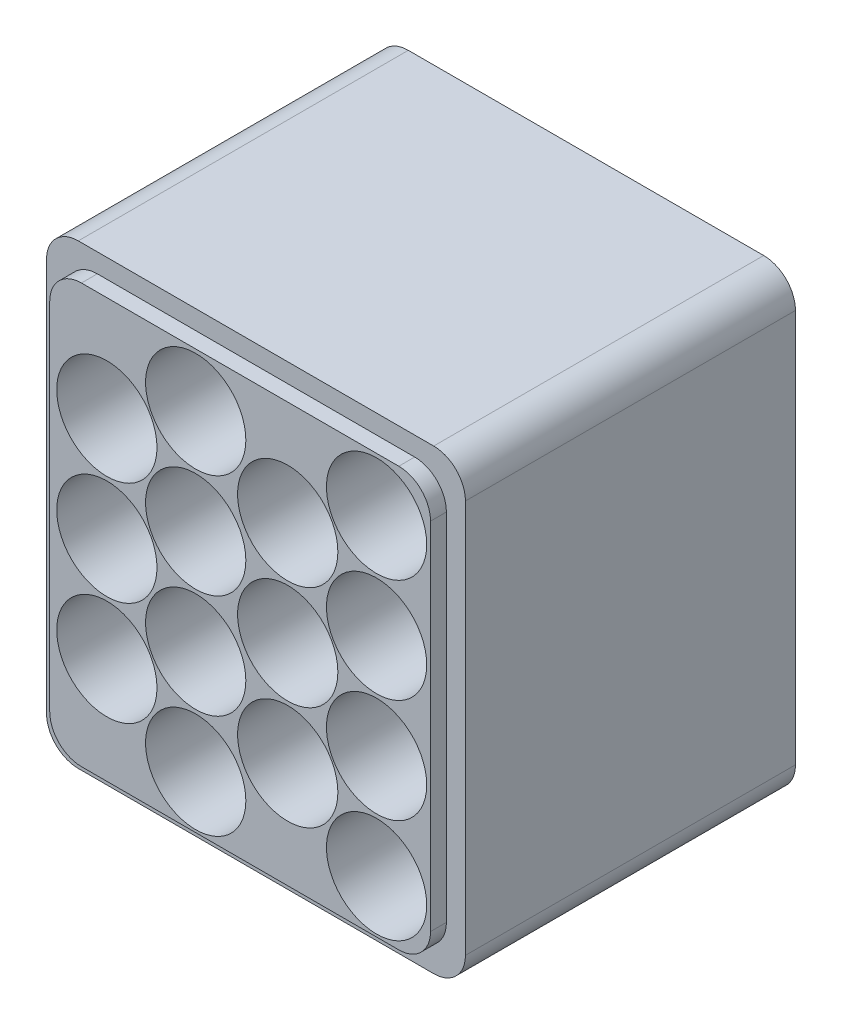
from build123d import *

# Parameters (mm, degrees)
SKETCH1_W                 = 66
SKETCH1_H                 = 72
BOSS_EXTRUDE1_DEPTH       = 52
SKETCH2_W                 = 60
SKETCH2_H                 = 66
BOSS_EXTRUDE2_DEPTH       = 2.5
SKETCH3_W                 = 62
SKETCH3_H                 = 68
CUT_EXTRUDE1_DEPTH        = 13
SKETCH4_R                 = 7.9
CUT_EXTRUDE2_DEPTH        = 37.5
LPATTERN1_COUNT           = 3
LPATTERN1_PITCH           = 16.4
LPATTERN1_COUNT_DIR2      = 2
LPATTERN1_PITCH_DIR2      = 28.5
SKETCH_PATTERN1_START     = 17
SKETCH_PATTERN1_OUTLINE_R = 7.9
SKETCH_PATTERN1_DEPTH     = 37.5
FILLET1_R                 = 5
FILLET2_R                 = 2


# Read off the part's stored shape, not the designer's step: Sketch-Pattern1
with BuildPart() as part:
    # Sketch1 → Boss-Extrude1 (new body)
    with BuildSketch(Plane.XY):
        Rectangle(SKETCH1_W, SKETCH1_H)
    extrude(amount=BOSS_EXTRUDE1_DEPTH)

    # Sketch2 → Boss-Extrude2 (add)
    with BuildSketch(Plane.XY.offset(52)):
        Rectangle(SKETCH2_W, SKETCH2_H)
    extrude(amount=BOSS_EXTRUDE2_DEPTH)

    # Sketch3 → Cut-Extrude1 (cut)
    with BuildSketch(Plane(origin=(0, 0, 0), x_dir=(-1, 0, 0), z_dir=(0, 0, -1))):
        Rectangle(SKETCH3_W, SKETCH3_H)
    extrude(amount=-CUT_EXTRUDE1_DEPTH, mode=Mode.SUBTRACT)

    # Sketch4 → Cut-Extrude2 (cut)
    with BuildSketch(Plane.XY.offset(54.5)):
        with Locations((21.5, 24.5)):
            Circle(SKETCH4_R)
    cut_extrude2 = extrude(amount=-CUT_EXTRUDE2_DEPTH, mode=Mode.SUBTRACT)

    # LPattern1: Cut-Extrude2 3 × 2
    with Locations(*[(-j * LPATTERN1_PITCH_DIR2, -i * LPATTERN1_PITCH, 0) for i in range(LPATTERN1_COUNT) for j in range(LPATTERN1_COUNT_DIR2) if (i, j) != (0, 0)]):
        add(cut_extrude2, mode=Mode.SUBTRACT)

    # Sketch-Pattern1 outline → Sketch-Pattern1 (cut)
    with BuildSketch(Plane.XY.offset(SKETCH_PATTERN1_START)):
        with Locations((7.5, 16.5)):
            Circle(SKETCH_PATTERN1_OUTLINE_R)
        with Locations((-21, -16.3)):
            Circle(SKETCH_PATTERN1_OUTLINE_R)
        with Locations((-21, 16.5)):
            Circle(SKETCH_PATTERN1_OUTLINE_R)
        with Locations((7.5, 0.1)):
            Circle(SKETCH_PATTERN1_OUTLINE_R)
        with Locations((-21, 0.1)):
            Circle(SKETCH_PATTERN1_OUTLINE_R)
        with Locations((7.5, -16.3)):
            Circle(SKETCH_PATTERN1_OUTLINE_R)
        with Locations((-7, -24.7)):
            Circle(SKETCH_PATTERN1_OUTLINE_R)
        with Locations((21.5, -24.7)):
            Circle(SKETCH_PATTERN1_OUTLINE_R)
    extrude(amount=SKETCH_PATTERN1_DEPTH, mode=Mode.SUBTRACT)

    # Fillet1
    fillet1_edges = [part.edges().sort_by_distance(p)[0] for p in [
        (30, 33, 53.25),
        (-30, 33, 53.25),
        (-30, -33, 53.25),
        (30, -33, 53.25),
        (-31, -34, 6.5),
        (31, -34, 6.5),
        (31, 34, 6.5),
        (-31, 34, 6.5),
        (-33, 36, 26),
        (33, 36, 26),
        (33, -36, 26),
        (-33, -36, 26),
    ]]
    fillet(fillet1_edges, radius=FILLET1_R)

    # Fillet2
    fillet2_edges = [part.edges().sort_by_distance(p)[0] for p in [
        (0, -34, 13),
        (31, 0, 13),
        (-31, 0, 13),
        (0, 34, 13),
        (-29.535533906, 32.535533906, 13),
        (-29.535533906, -32.535533906, 13),
        (29.535533906, 32.535533906, 13),
        (29.535533906, -32.535533906, 13),
    ]]
    fillet(fillet2_edges, radius=FILLET2_R)


solid = part.part
